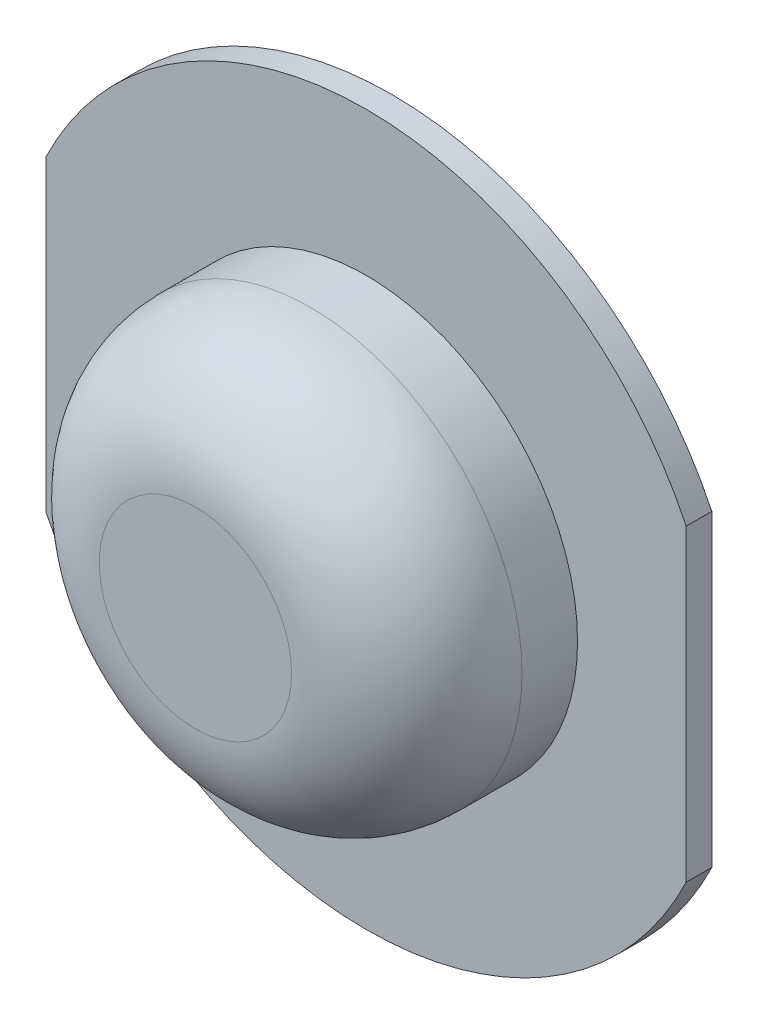
from build123d import *

# Parameters (mm, degrees)
BOSS_EXTRUDE1_DEPTH      = 4
SKETCH6_W                = 52.54
SKETCH6_H                = 52.54
CUT_EXTRUDE2_DEPTH       = 0.25
CUT_EXTRUDE3_DEPTH       = 0.3
CIRPATTERN1_COUNT        = 4
BOSS_EXTRUDE3_DEPTH      = 26.68
BOSS_EXTRUDE3_DEPTH_BACK = 3
SKETCH9_R                = 33.02
FILLET2_R                = 18


with BuildPart() as part:
    # Sketch1 → Boss-Extrude1 (new body)
    with BuildSketch(Plane.XY):
        with BuildLine():
            Line((50, 24.088378941), (50, -24.088378941))
            ThreePointArc((50, -24.088378941), (0, -55.5), (-50, -24.088378941))
            Line((-50, -24.088378941), (-50, 24.088378941))
            ThreePointArc((-50, 24.088378941), (0, 55.5), (50, 24.088378941))
        make_face()
    extrude(amount=BOSS_EXTRUDE1_DEPTH)

    # Sketch6 → Cut-Extrude2 (cut)
    with BuildSketch(Plane(origin=(0, 0, 0), x_dir=(-1, 0, 0), z_dir=(0, 0, -1))):
        Rectangle(SKETCH6_W, SKETCH6_H)
    extrude(amount=-CUT_EXTRUDE2_DEPTH, mode=Mode.SUBTRACT)

    # Sketch7 → Cut-Revolve1 (revolve, cut)
    with BuildSketch(Plane(origin=(0, 0, 0), x_dir=(1, 0, 0), z_dir=(0, 1, 0))):
        with BuildLine():
            Line((0, -0.25), (0, -25.25))
            ThreePointArc((0, -25.25), (17.67766953, -17.92766953), (25, -0.25))
            Line((25, -0.25), (0, -0.25))
        make_face()
    revolve(axis=Axis((0, 0, 0.25), (0, 0, 1)), mode=Mode.SUBTRACT)

    # Sketch8 → Cut-Extrude3 (cut)
    with BuildSketch(Plane(origin=(0, 0, 0.25), x_dir=(-1, 0, 0), z_dir=(0, 0, -1))):
        with BuildLine():
            Line((-19.887048211, -15.149432777), (-15.149432777, -19.887048211))
            Line((-15.149432777, -19.887048211), (-17.801083206, -22.53869864))
            ThreePointArc((-17.801083206, -22.53869864), (-19.215296769, -23.124485078), (-20.629510331, -22.53869864))
            Line((-20.629510331, -22.53869864), (-22.53869864, -20.629510331))
            ThreePointArc((-22.53869864, -20.629510331), (-23.124485078, -19.215296769), (-22.53869864, -17.801083206))
            Line((-22.53869864, -17.801083206), (-19.887048211, -15.149432777))
        make_face()
    cut_extrude3 = extrude(amount=-CUT_EXTRUDE3_DEPTH, mode=Mode.SUBTRACT)

    # CirPattern1: Cut-Extrude3 ×4 about axis
    cirpattern1_axis = Axis((0, 0, 0), (0, 0, 1))
    for i in range(1, CIRPATTERN1_COUNT):
        add(cut_extrude3.rotate(cirpattern1_axis, i * 360 / CIRPATTERN1_COUNT), mode=Mode.SUBTRACT)

    # Sketch9 → Boss-Extrude3 (add, two sides: drawn at the far end of the back side and taken through both)
    with BuildSketch(Plane.XY.offset(4).offset(-BOSS_EXTRUDE3_DEPTH_BACK)):
        Circle(SKETCH9_R)
    extrude(amount=BOSS_EXTRUDE3_DEPTH + BOSS_EXTRUDE3_DEPTH_BACK)

    # Fillet2
    fillet2_edges = [part.edges().sort_by_distance(p)[0] for p in [
        (-33.02, 0, 30.68),
    ]]
    fillet(fillet2_edges, radius=FILLET2_R)


solid = part.part
